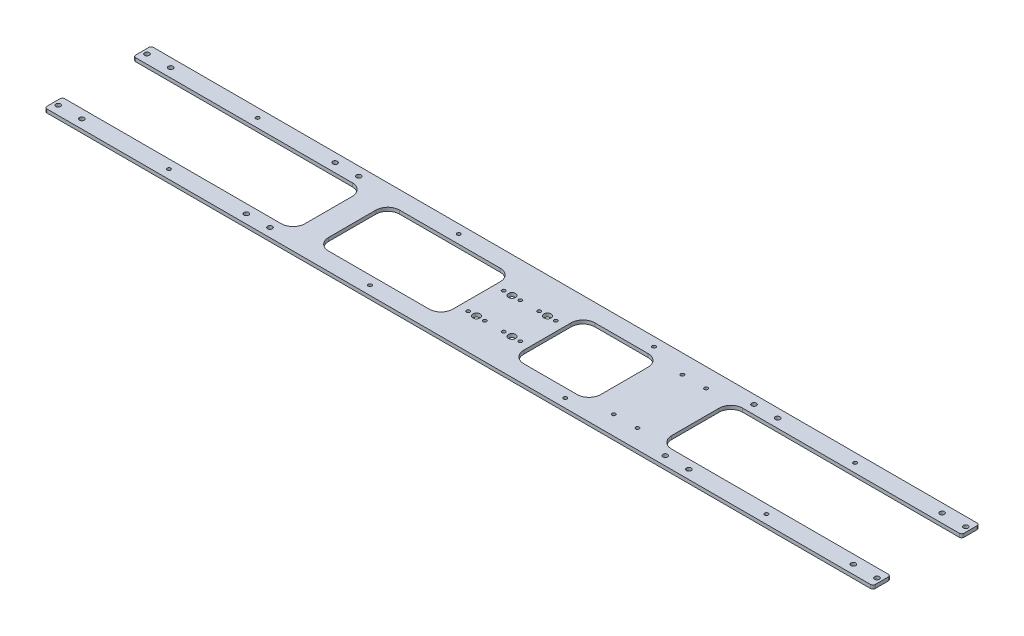
from build123d import *

# Parameters (mm, degrees)
SKETCH_1_W                                   = 700
SKETCH_1_H                                   = 90
SKETCH_1_W_2                                 = 270
SKETCH_1_H_2                                 = 60
EXTRUDE_1_DEPTH                              = 3
SKETCH_2_W                                   = 195
SKETCH_2_H                                   = 60
CUT_EXTRUDE_1_DEPTH                          = 4
SKETCH_4_R                                   = 2
CUT_EXTRUDE_2_DEPTH                          = 15
MIRROR_2_AT_THE_SECOND_PLANE_COPY_1_SKET_R   = 2
MIRROR_2_AT_THE_SECOND_PLANE_COPY_1_DEPTH    = 15
SKETCH_5_W                                   = 60
SKETCH_5_H                                   = 60
EXTRUDE_2_DEPTH                              = 3
SKETCH_6_R                                   = 1.5
CUT_EXTRUDE_3_DEPTH                          = 4
MIRROR_3_AT_THE_SECOND_PLANE_COPY_1_SKET_R   = 1.5
MIRROR_3_AT_THE_SECOND_PLANE_COPY_1_DEPTH    = 4
SKETCH_9_W                                   = 40
SKETCH_9_H                                   = 60
EXTRUDE_4_DEPTH                              = 3
FILLET_1_R                                   = 2
MIRROR_6_DEPTH                               = 3
EXTRUDE_3_DEPTH                              = 3
MIRROR_9_AT_THE_SECOND_PLANE_COPY_1_DEPTH    = 3
SKETCH_8_R                                   = 3
SKETCH_8_R_2                                 = 1.5
CUT_EXTRUDE_4_DEPTH                          = 15
SKETCH_10_R                                  = 1.5
CUT_EXTRUDE_5_DEPTH                          = 38
MIRROR_10_AT_THE_SECOND_PLANE_COPY_1_SKE_R   = 3
MIRROR_10_AT_THE_SECOND_PLANE_COPY_1_SKE_R_2 = 1.5
MIRROR_10_AT_THE_SECOND_PLANE_COPY_1_DEPTH   = 15
FILLET_2_R                                   = 10


# Read off the part's stored shape, not the designer's step: 镜向6
with BuildPart() as part:
    # 草图1 → 凸台-拉伸1 (new body)
    with BuildSketch(Plane(origin=(0, 0, 0), x_dir=(1, 0, 0), z_dir=(0, 1, 0))):
        Rectangle(SKETCH_1_W, SKETCH_1_H)
        Rectangle(SKETCH_1_W_2, SKETCH_1_H_2, mode=Mode.SUBTRACT)
    extrude(amount=EXTRUDE_1_DEPTH)

    # 草图2 → 切除-拉伸1 (cut)
    with BuildSketch(Plane(origin=(0, 3, 0), x_dir=(1, 0, 0), z_dir=(0, 1, 0))):
        with Locations((-252.5, 0)):
            Rectangle(SKETCH_2_W, SKETCH_2_H)
    cut_extrude_1 = extrude(amount=-CUT_EXTRUDE_1_DEPTH, mode=Mode.SUBTRACT)

    # 镜向1: 切除-拉伸1 across plane
    add(cut_extrude_1.mirror(Plane(origin=(0, 0, 0), x_dir=(0, 0, 1), z_dir=(1, 0, 0))), mode=Mode.SUBTRACT)

    # 草图4 → 切除-拉伸2 (cut)
    with BuildSketch(Plane(origin=(0, 3, 0), x_dir=(1, 0, 0), z_dir=(0, 1, 0))):
        with Locations(Location((-187, 37.5, 0), (0, 0, 270))):
            Circle(SKETCH_4_R)
        with Locations(Location((-167, 37.5, 0), (0, 0, 270))):
            Circle(SKETCH_4_R)
        with Locations(Location((-346, 37.5, 0), (0, 0, 270))):
            Circle(SKETCH_4_R)
        with Locations(Location((-326, 37.5, 0), (0, 0, 270))):
            Circle(SKETCH_4_R)
    cut_extrude_2 = extrude(amount=-CUT_EXTRUDE_2_DEPTH, mode=Mode.SUBTRACT)

    # 镜向2: 切除-拉伸2 across plane
    add(cut_extrude_2.mirror(Plane(origin=(0, 0, 0), x_dir=(0, 0, 1), z_dir=(1, 0, 0))), mode=Mode.SUBTRACT)

    # 镜向2 at the second plane: 切除-拉伸2 across plane
    add(cut_extrude_2.mirror(Plane.XY), mode=Mode.SUBTRACT)

    # 镜向2 at the second plane copy 1 sket → 镜向2 at the second plane copy 1 (cut)
    with BuildSketch(Plane(origin=(0, 3, 0), x_dir=(-1, 0, 0), z_dir=(0, 1, 0))):
        with Locations(Location((-187, 37.5, 0), (0, 0, 270))):
            Circle(MIRROR_2_AT_THE_SECOND_PLANE_COPY_1_SKET_R)
        with Locations(Location((-167, 37.5, 0), (0, 0, 270))):
            Circle(MIRROR_2_AT_THE_SECOND_PLANE_COPY_1_SKET_R)
        with Locations(Location((-346, 37.5, 0), (0, 0, 270))):
            Circle(MIRROR_2_AT_THE_SECOND_PLANE_COPY_1_SKET_R)
        with Locations(Location((-326, 37.5, 0), (0, 0, 270))):
            Circle(MIRROR_2_AT_THE_SECOND_PLANE_COPY_1_SKET_R)
    extrude(amount=-MIRROR_2_AT_THE_SECOND_PLANE_COPY_1_DEPTH, mode=Mode.SUBTRACT)

    # 草图5 → 凸台-拉伸2 (add)
    with BuildSketch(Plane(origin=(0, 3, 0), x_dir=(1, 0, 0), z_dir=(0, 1, 0))):
        Rectangle(SKETCH_5_W, SKETCH_5_H)
    extrude(amount=-EXTRUDE_2_DEPTH)

    # 草图6 → 切除-拉伸3 (cut)
    with BuildSketch(Plane(origin=(0, 3, 0), x_dir=(1, 0, 0), z_dir=(0, 1, 0))):
        with Locations(Location((-252.5, 37.5, 0), (0, 0, 270))):
            Circle(SKETCH_6_R)
        with Locations(Location((-82.5, 37.5, 0), (0, 0, 270))):
            Circle(SKETCH_6_R)
    cut_extrude_3 = extrude(amount=-CUT_EXTRUDE_3_DEPTH, mode=Mode.SUBTRACT)

    # 镜向3: 切除-拉伸3 across plane
    add(cut_extrude_3.mirror(Plane.XY), mode=Mode.SUBTRACT)

    # 镜向3 at the second plane: 切除-拉伸3 across plane
    add(cut_extrude_3.mirror(Plane(origin=(0, 0, 0), x_dir=(0, 0, 1), z_dir=(1, 0, 0))), mode=Mode.SUBTRACT)

    # 镜向3 at the second plane copy 1 sket → 镜向3 at the second plane copy 1 (cut)
    with BuildSketch(Plane(origin=(0, 3, 0), x_dir=(-1, 0, 0), z_dir=(0, 1, 0))):
        with Locations(Location((-252.5, 37.5, 0), (0, 0, 270))):
            Circle(MIRROR_3_AT_THE_SECOND_PLANE_COPY_1_SKET_R)
        with Locations(Location((-82.5, 37.5, 0), (0, 0, 270))):
            Circle(MIRROR_3_AT_THE_SECOND_PLANE_COPY_1_SKET_R)
    extrude(amount=-MIRROR_3_AT_THE_SECOND_PLANE_COPY_1_DEPTH, mode=Mode.SUBTRACT)

    # 草图9 → 凸台-拉伸4 (add)
    with BuildSketch(Plane(origin=(0, 3, 0), x_dir=(1, 0, 0), z_dir=(0, 1, 0))):
        with Locations((115, 0)):
            Rectangle(SKETCH_9_W, SKETCH_9_H)
    extrude(amount=-EXTRUDE_4_DEPTH)

    # 圆角1
    fillet_1_edges = [part.edges().sort_by_distance(p)[0] for p in [
        (-350, 1.5, -30),
        (-350, 1.5, -45),
    ]]
    fillet(fillet_1_edges, radius=FILLET_1_R)

    # 镜向6 outline → 镜向6 (cut)
    with BuildSketch(Plane(origin=(0, 0, 0), x_dir=(1, 0, 0), z_dir=(0, 1, 0))):
        with BuildLine():
            Line((350, 45), (348, 45))
            ThreePointArc((348, 45), (349.414213562, 44.414213562), (350, 43))
            Line((350, 43), (350, 45))
        make_face()
        with BuildLine():
            Line((350, 30), (350, 32))
            ThreePointArc((350, 32), (349.414213562, 30.585786438), (348, 30))
            Line((348, 30), (350, 30))
        make_face()
        with BuildLine():
            Line((-350, -45), (-348, -45))
            ThreePointArc((-348, -45), (-349.414213562, -44.414213562), (-350, -43))
            Line((-350, -43), (-350, -45))
        make_face()
        with BuildLine():
            ThreePointArc((348, -30), (349.414213562, -30.585786438), (350, -32))
            Line((350, -32), (350, -30))
            Line((350, -30), (348, -30))
        make_face()
        with BuildLine():
            ThreePointArc((350, -43), (349.414213562, -44.414213562), (348, -45))
            Line((348, -45), (350, -45))
            Line((350, -45), (350, -43))
        make_face()
        with BuildLine():
            Line((-350, -30), (-350, -32))
            ThreePointArc((-350, -32), (-349.414213562, -30.585786438), (-348, -30))
            Line((-348, -30), (-350, -30))
        make_face()
    extrude(amount=MIRROR_6_DEPTH, mode=Mode.SUBTRACT)

    # 草图7 → 凸台-拉伸3 (add)
    with BuildSketch(Plane(origin=(0, 3, 0), x_dir=(1, 0, 0), z_dir=(0, 1, 0))):
        with BuildLine():
            Line((-165, 30), (-155, 30))
            Line((-155, 30), (-155, 20))
            ThreePointArc((-155, 20), (-157.928932188, 27.071067812), (-165, 30))
        make_face()
        with BuildLine():
            Line((-135, 20), (-135, 30))
            Line((-135, 30), (-125, 30))
            ThreePointArc((-125, 30), (-132.071067812, 27.071067812), (-135, 20))
        make_face()
        with BuildLine():
            Line((-40, 30), (-30, 30))
            Line((-30, 30), (-30, 20))
            ThreePointArc((-30, 20), (-32.928932188, 27.071067812), (-40, 30))
        make_face()
    extrude_3 = extrude(amount=-EXTRUDE_3_DEPTH)

    # 镜向9: 凸台-拉伸3 across plane
    add(extrude_3.mirror(Plane(origin=(0, 0, 0), x_dir=(0, 0, 1), z_dir=(1, 0, 0))))

    # 镜向9 at the second plane: 凸台-拉伸3 across plane
    add(extrude_3.mirror(Plane.XY))

    # 镜向9 at the second plane copy 1 sket → 镜向9 at the second plane copy 1 (add)
    with BuildSketch(Plane(origin=(0, 3, 0), x_dir=(-1, 0, 0), z_dir=(0, 1, 0))):
        with BuildLine():
            Line((-165, 30), (-155, 30))
            Line((-155, 30), (-155, 20))
            ThreePointArc((-155, 20), (-157.928932188, 27.071067812), (-165, 30))
        make_face()
        with BuildLine():
            Line((-135, 20), (-135, 30))
            Line((-135, 30), (-125, 30))
            ThreePointArc((-125, 30), (-132.071067812, 27.071067812), (-135, 20))
        make_face()
        with BuildLine():
            Line((-40, 30), (-30, 30))
            Line((-30, 30), (-30, 20))
            ThreePointArc((-30, 20), (-32.928932188, 27.071067812), (-40, 30))
        make_face()
    extrude(amount=-MIRROR_9_AT_THE_SECOND_PLANE_COPY_1_DEPTH)

    # 草图8 → 切除-拉伸4 (cut)
    with BuildSketch(Plane(origin=(0, 3, 0), x_dir=(1, 0, 0), z_dir=(0, 1, 0))):
        with Locations(Location((-15, 15, 0), (0, 0, 270))):
            Circle(SKETCH_8_R)
        with Locations(Location((-22, 15, 0), (0, 0, 270))):
            Circle(SKETCH_8_R_2)
        with Locations(Location((-8, 15, 0), (0, 0, 270))):
            Circle(SKETCH_8_R_2)
    cut_extrude_4 = extrude(amount=-CUT_EXTRUDE_4_DEPTH, mode=Mode.SUBTRACT)

    # 草图10 → 切除-拉伸5 (cut)
    with BuildSketch(Plane(origin=(0, 3, 0), x_dir=(1, 0, 0), z_dir=(0, 1, 0))):
        with Locations(Location((115, 29, 0), (0, 0, 270))):
            Circle(SKETCH_10_R)
        with Locations(Location((135, 29, 0), (0, 0, 270))):
            Circle(SKETCH_10_R)
        with Locations(Location((135, -29, 0), (0, 0, 270))):
            Circle(SKETCH_10_R)
        with Locations(Location((115, -29, 0), (0, 0, 270))):
            Circle(SKETCH_10_R)
    extrude(amount=-CUT_EXTRUDE_5_DEPTH, mode=Mode.SUBTRACT)

    # 镜向10: 切除-拉伸4 across plane
    add(cut_extrude_4.mirror(Plane.XY), mode=Mode.SUBTRACT)

    # 镜向10 at the second plane: 切除-拉伸4 across plane
    add(cut_extrude_4.mirror(Plane(origin=(0, 0, 0), x_dir=(0, 0, 1), z_dir=(1, 0, 0))), mode=Mode.SUBTRACT)

    # 镜向10 at the second plane copy 1 ske → 镜向10 at the second plane copy 1 (cut)
    with BuildSketch(Plane(origin=(0, 3, 0), x_dir=(-1, 0, 0), z_dir=(0, 1, 0))):
        with Locations(Location((-15, 15, 0), (0, 0, 270))):
            Circle(MIRROR_10_AT_THE_SECOND_PLANE_COPY_1_SKE_R)
        with Locations(Location((-22, 15, 0), (0, 0, 270))):
            Circle(MIRROR_10_AT_THE_SECOND_PLANE_COPY_1_SKE_R_2)
        with Locations(Location((-8, 15, 0), (0, 0, 270))):
            Circle(MIRROR_10_AT_THE_SECOND_PLANE_COPY_1_SKE_R_2)
    extrude(amount=-MIRROR_10_AT_THE_SECOND_PLANE_COPY_1_DEPTH, mode=Mode.SUBTRACT)

    # 圆角2
    fillet_2_edges = [part.edges().sort_by_distance(p)[0] for p in [
        (95, 1.5, -30),
        (95, 1.5, 30),
    ]]
    fillet(fillet_2_edges, radius=FILLET_2_R)


solid = part.part
